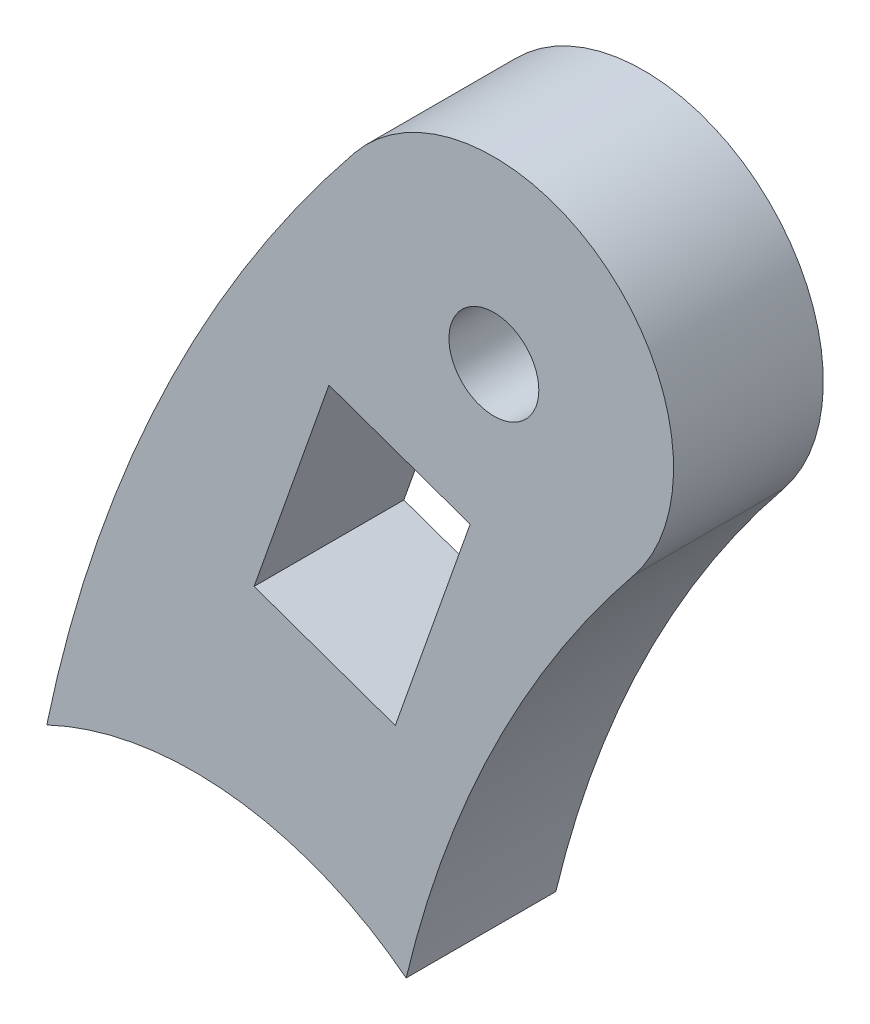
from build123d import *

# Parameters (mm, degrees)
ESQUISSE1_R        = 1.5
BOSS_EXTRU_1_DEPTH = 5


with BuildPart() as part:
    # Esquisse1 → Boss.-Extru.1 (new body)
    with BuildSketch(Plane.XY):
        with BuildLine():
            ThreePointArc((-39.666666667, 32.055507414), (-46.089810322, 21.834133472), (-49.930555556, 10.389399497))
            ThreePointArc((-49.930555556, 10.389399497), (-43.743567635, 11.431158196), (-37.930555556, 9.070444049))
            ThreePointArc((-37.930555556, 9.070444049), (-34.994400066, 17.216037988), (-30.333333333, 24.513035081))
            ThreePointArc((-30.333333333, 24.513035081), (-31.228763834, 32.950937914), (-39.666666667, 32.055507414))
        make_face()
        with Locations((-35, 28.284271247)):
            Circle(ESQUISSE1_R, mode=Mode.SUBTRACT)
        Polygon((-43.0072871, 17.857022604), (-38.293241892, 16.190355937), (-35.793241892, 23.261423749), (-40.5072871, 24.928090416), align=None, mode=Mode.SUBTRACT)
    extrude(amount=BOSS_EXTRU_1_DEPTH)


solid = part.part
